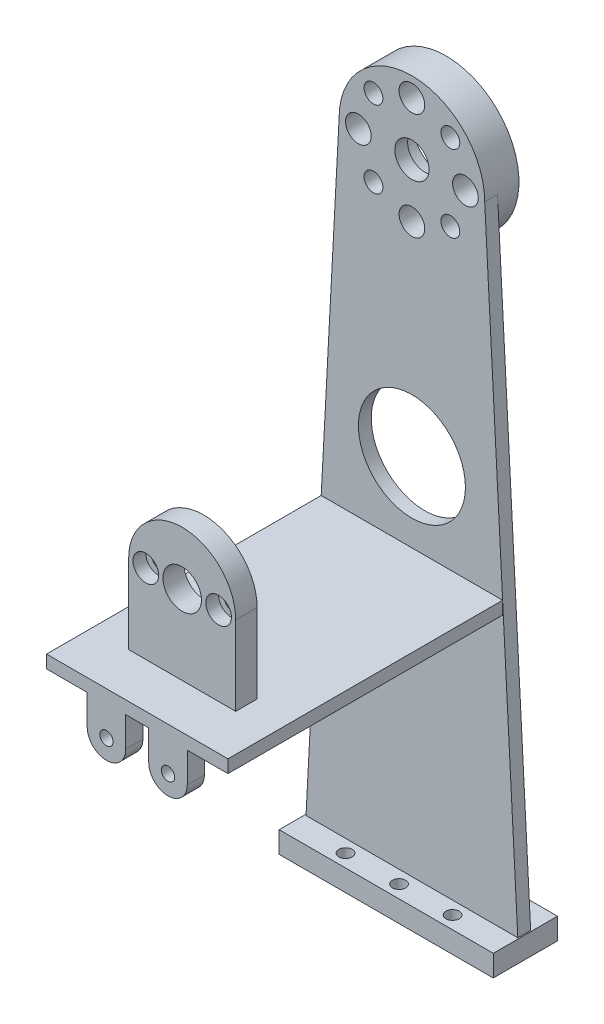
from build123d import *
from build123d.topology import SkipClean

# Parameters (mm, degrees)
SKETCH1_R           = 4
SKETCH1_R_2         = 12.5
BOSS_EXTRUDE1_DEPTH = 3
BOSS_EXTRUDE2_START = 5
SKETCH2_R           = 17
SKETCH2_R_2         = 8
BOSS_EXTRUDE2_DEPTH = 5
SKETCH3_R           = 1.55
SKETCH3_R_2         = 1
CUT_EXTRUDE1_DEPTH  = 8
SKETCH4_R           = 3
SKETCH4_R_2         = 2.2
CUT_EXTRUDE2_DEPTH  = 4.5
SKETCH5_W           = 50
SKETCH5_H           = 15
SKETCH5_R           = 1.55
BOSS_EXTRUDE3_DEPTH = 5
SKETCH9_W           = 42.373333334
SKETCH9_H           = 64.15
BOSS_EXTRUDE6_DEPTH = 3
SKETCH11_R          = 1.55
SKETCH11_R_2        = 4.5
BOSS_EXTRUDE7_DEPTH = 5
SKETCH12_R          = 1.55
BOSS_EXTRUDE8_DEPTH = 4
SKETCH13_R          = 3
CUT_EXTRUDE3_DEPTH  = 3


with BuildPart() as part:
    # Sketch1 → Boss-Extrude1 (new body)
    with BuildSketch(Plane.XY):
        with BuildLine():
            Line((-25, 0), (25, 0))
            Line((25, 0), (17, 150))
            ThreePointArc((17, 150), (0, 167), (-17, 150))
            Line((-17, 150), (-25, 0))
        make_face()
        with Locations((0, 150)):
            Circle(SKETCH1_R, mode=Mode.SUBTRACT)
        with Locations((0, 90)):
            Circle(SKETCH1_R_2, mode=Mode.SUBTRACT)
    extrude(amount=BOSS_EXTRUDE1_DEPTH)

    # Sketch2 → Boss-Extrude2 (add)
    with SkipClean():  # the faces are left unmerged after this step: merging them gives an invalid solid
        with BuildSketch(Plane(origin=(0, 0, 0), x_dir=(-1, 0, 0), z_dir=(0, 0, -1)).offset(BOSS_EXTRUDE2_START)):
            with Locations((0, 150)):
                Circle(SKETCH2_R)
            with Locations((0, 150)):
                Circle(SKETCH2_R_2, mode=Mode.SUBTRACT)
        extrude(amount=-BOSS_EXTRUDE2_DEPTH)

    # Sketch3 → Cut-Extrude1 (cut)
    with SkipClean():  # the faces are left unmerged after this step: merging them gives an invalid solid
        with BuildSketch(Plane.XY.offset(3)):
            with Locations((-12.5, 150)):
                Circle(SKETCH3_R)
            with Locations((0, 162.5)):
                Circle(SKETCH3_R)
            with Locations((12.5, 150)):
                Circle(SKETCH3_R)
            with Locations((0, 137.5)):
                Circle(SKETCH3_R)
            with Locations((8.980256121, 158.980256121)):
                Circle(SKETCH3_R_2)
            with Locations((8.980256121, 141.019743879)):
                Circle(SKETCH3_R_2)
            with Locations((-8.980256121, 141.019743879)):
                Circle(SKETCH3_R_2)
            with Locations((-8.980256121, 158.980256121)):
                Circle(SKETCH3_R_2)
        extrude(amount=-CUT_EXTRUDE1_DEPTH, mode=Mode.SUBTRACT)

    # Sketch4 → Cut-Extrude2 (cut)
    with SkipClean():  # the faces are left unmerged after this step: merging them gives an invalid solid
        with BuildSketch(Plane.XY.offset(3)):
            with Locations((-12.5, 150)):
                Circle(SKETCH4_R)
            with Locations((0, 162.5)):
                Circle(SKETCH4_R)
            with Locations((12.5, 150)):
                Circle(SKETCH4_R)
            with Locations((0, 137.5)):
                Circle(SKETCH4_R)
            with Locations((-8.980256121, 158.980256121)):
                Circle(SKETCH4_R_2)
            with Locations((8.980256121, 158.980256121)):
                Circle(SKETCH4_R_2)
            with Locations((8.980256121, 141.019743879)):
                Circle(SKETCH4_R_2)
            with Locations((-8.980256121, 141.019743879)):
                Circle(SKETCH4_R_2)
        extrude(amount=-CUT_EXTRUDE2_DEPTH, mode=Mode.SUBTRACT)

    # Sketch5 → Boss-Extrude3 (add)
    with SkipClean():  # the faces are left unmerged after this step: merging them gives an invalid solid
        with BuildSketch(Plane.XZ):
            with Locations((0, 1.5)):
                Rectangle(SKETCH5_W, SKETCH5_H)
            with Locations((-12.5, 6)):
                Circle(SKETCH5_R, mode=Mode.SUBTRACT)
            with Locations((0, 6)):
                Circle(SKETCH5_R, mode=Mode.SUBTRACT)
            with Locations((12.5, 6)):
                Circle(SKETCH5_R, mode=Mode.SUBTRACT)
            with Locations((0, -3)):
                Circle(SKETCH5_R, mode=Mode.SUBTRACT)
            with Locations((-12.5, -3)):
                Circle(SKETCH5_R, mode=Mode.SUBTRACT)
            with Locations((12.5, -3)):
                Circle(SKETCH5_R, mode=Mode.SUBTRACT)
        extrude(amount=-BOSS_EXTRUDE3_DEPTH)

    # Sketch9 → Boss-Extrude6 (add)
    with SkipClean():  # the faces are left unmerged after this step: merging them gives an invalid solid
        with BuildSketch(Plane.XZ.offset(-71.5)):
            with Locations((0, 35.075)):
                Rectangle(SKETCH9_W, SKETCH9_H)
        extrude(amount=BOSS_EXTRUDE6_DEPTH)

    # Sketch11 → Boss-Extrude7 (add)
    with SkipClean():  # the faces are left unmerged after this step: merging them gives an invalid solid
        with BuildSketch(Plane.XY.offset(51.65)):
            with BuildLine():
                Line((-12.5, 90), (-12.5, 71.5))
                Line((-12.5, 71.5), (12.5, 71.5))
                Line((12.5, 71.5), (12.5, 90))
                ThreePointArc((12.5, 90), (0, 102.5), (-12.5, 90))
            make_face()
            with Locations((-8.5, 90)):
                Circle(SKETCH11_R, mode=Mode.SUBTRACT)
            with Locations((8.5, 90)):
                Circle(SKETCH11_R, mode=Mode.SUBTRACT)
            with Locations((0, 90)):
                Circle(SKETCH11_R_2, mode=Mode.SUBTRACT)
        extrude(amount=BOSS_EXTRUDE7_DEPTH)

    # Sketch12 → Boss-Extrude8 (add)
    # profile 1 of 2: a face of its own
    with SkipClean():  # the faces are left unmerged after this step: merging them gives an invalid solid
        with BuildSketch(Plane.XY.offset(67.15)):
            with BuildLine():
                Line((-11.686666667, 61.5), (-11.686666667, 68.5))
                Line((-11.686666667, 68.5), (-2.686666667, 68.5))
                Line((-2.686666667, 68.5), (-2.686666667, 61.5))
                ThreePointArc((-2.686666667, 61.5), (-7.186666667, 57), (-11.686666667, 61.5))
            make_face()
            with Locations((-7.186666667, 61.5)):
                Circle(SKETCH12_R, mode=Mode.SUBTRACT)
        # profile 2 of 2: a face of its own
        with BuildSketch(Plane.XY.offset(67.15)):
            with BuildLine():
                Line((2.686666667, 61.5), (2.686666667, 68.5))
                Line((2.686666667, 68.5), (11.686666667, 68.5))
                Line((11.686666667, 68.5), (11.686666667, 61.5))
                ThreePointArc((11.686666667, 61.5), (7.186666667, 57), (2.686666667, 61.5))
            make_face()
            with Locations((7.186666667, 61.5)):
                Circle(SKETCH12_R, mode=Mode.SUBTRACT)
        extrude(amount=-BOSS_EXTRUDE8_DEPTH)

    # Sketch13 → Cut-Extrude3 (cut)
    with SkipClean():  # the faces are left unmerged after this step: merging them gives an invalid solid
        with BuildSketch(Plane.XY.offset(56.65)):
            with Locations((-8.5, 90)):
                Circle(SKETCH13_R)
            with Locations((8.5, 90)):
                Circle(SKETCH13_R)
        extrude(amount=-CUT_EXTRUDE3_DEPTH, mode=Mode.SUBTRACT)


solid = part.part
